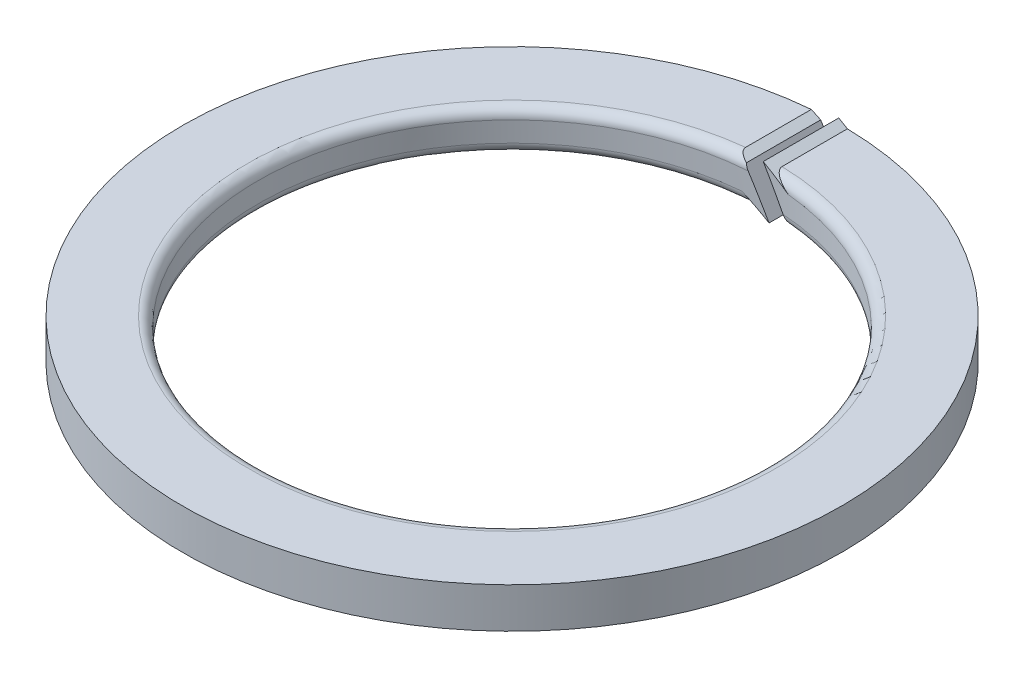
from build123d import *

# Parameters (mm, degrees)
BODYSKE_W       = 15
BODYSKE_H       = 20
CUT_EXTRASKE_W  = 131
CUT_EXTRASKE_H  = 6
CUT_EXTRA_DEPTH = 94.16920092
TYPE_A_DEPTH    = 94.16920092
FILLET1_R       = 2


with BuildPart() as part:
    # BodySke → BaseBody (revolve)
    with BuildSketch(Plane.XY):
        with Locations((58, 0)):
            Rectangle(BODYSKE_W, BODYSKE_H)
    revolve(axis=Axis((0, 0, 0), (0, 1, 0)))

    # Cut-ExtraSke → Cut-Extra (cut, through all)
    with BuildSketch(Plane.XY):
        with Locations((0, -7)):
            Rectangle(CUT_EXTRASKE_W, CUT_EXTRASKE_H)
        with Locations((0, 7)):
            Rectangle(CUT_EXTRASKE_W, CUT_EXTRASKE_H)
    extrude(amount=CUT_EXTRA_DEPTH, mode=Mode.SUBTRACT)

    # ASke → Type-A (cut, through all)
    with BuildSketch(Plane.XY):
        Polygon((0.577350269, -5), (-1.154700538, -4), (-65.5, -4), (-65.5, -10), (65.5, -10), (65.5, -4), (5.773502692, -4), (4.041451884, -3), (-0.577350269, 5), (1.154700538, 4), (65.5, 4), (65.5, 10), (-65.5, 10), (-65.5, 4), (-5.773502692, 4), (-4.041451884, 3), align=None)
    extrude(amount=-TYPE_A_DEPTH, mode=Mode.SUBTRACT)

    # Fillet1
    fillet1_edges = [part.edges().sort_by_distance(p)[0] for p in [
        (-35.298283406, -4, 36.11483336),
        (-33.605714648, 4, 37.694906061),
    ]]
    fillet(fillet1_edges, radius=FILLET1_R)


solid = part.part
